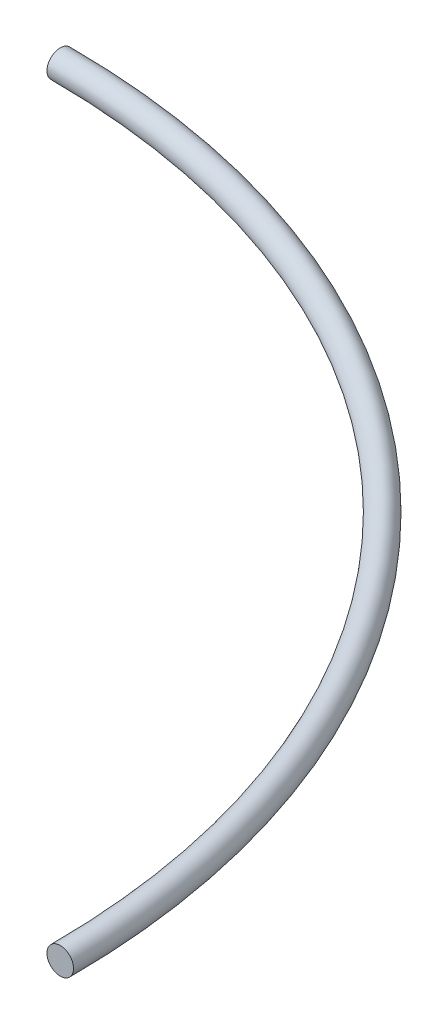
from build123d import *

# Parameters (mm, degrees)
SKETCH1_R      = 25
REVOLVE1_ANGLE = 90


with BuildPart() as part:
    # Sketch1 → Revolve1 (revolve)
    with BuildSketch(Plane.XY):
        with Locations((1460, 0)):
            Circle(SKETCH1_R)
    revolve(axis=Axis((0, 0, 0), (0, 1, 0)), revolution_arc=REVOLVE1_ANGLE)


solid = part.part
